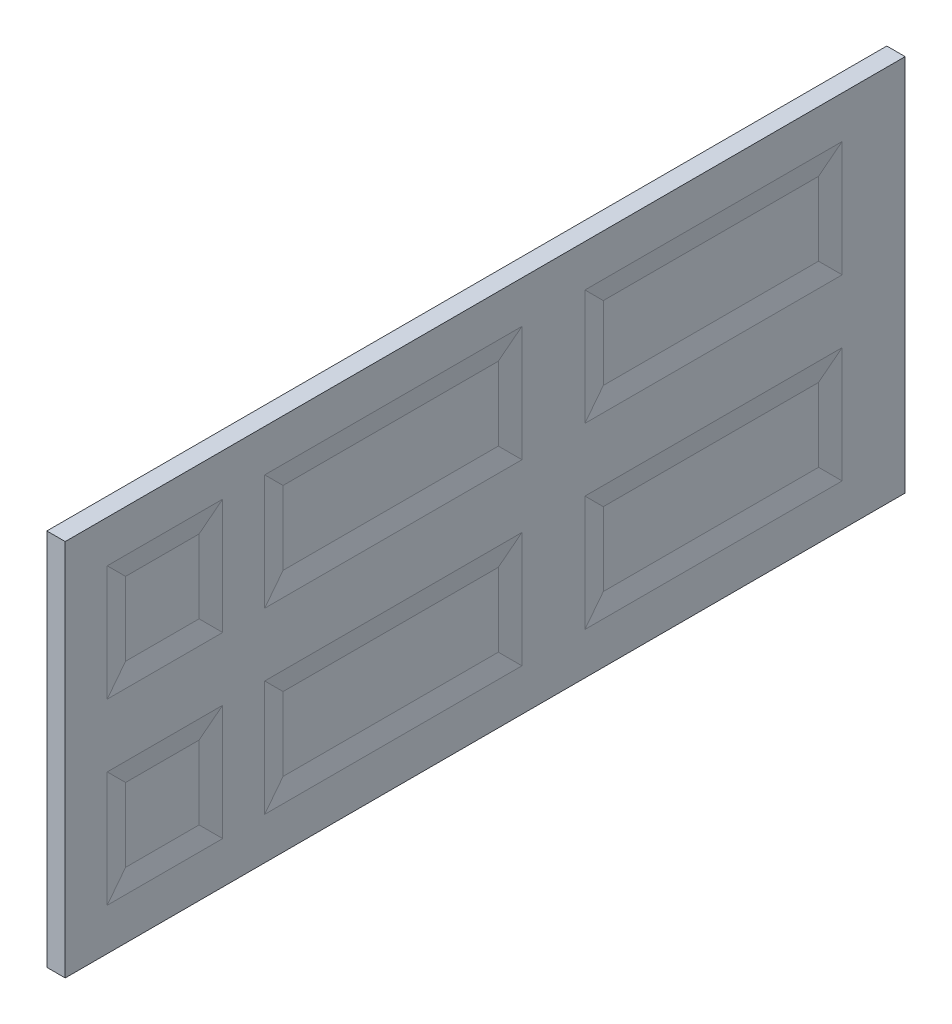
from build123d import *
from OCP.BRepFilletAPI import BRepFilletAPI_MakeChamfer

# Parameters (mm, degrees)
SKETCH1_W           = 914.4
SKETCH1_H           = 2032
BOSS_EXTRUDE1_DEPTH = 44.45
SKETCH2_W           = 177.8
SKETCH2_H           = 520.7
SKETCH2_H_2         = 177.8
CUT_EXTRUDE1_DEPTH  = 6.35
CHAMFER1_SIZE       = 50.8
CHAMFER1_SIZE_2     = 6.35
SKETCH3_W           = 168.710436435
SKETCH3_H           = 525.244781783
SKETCH3_H_2         = 168.710436435
SKETCH3_H_3         = 525.244781782
CUT_EXTRUDE2_DEPTH  = 6.35
CHAMFER2_SIZE       = 50.8
CHAMFER2_SIZE_2     = 6.35


with BuildPart() as part:
    # Sketch1 → Boss-Extrude1 (new body)
    with BuildSketch(Plane.YZ):
        Rectangle(SKETCH1_W, SKETCH1_H)
    extrude(amount=BOSS_EXTRUDE1_DEPTH)

    # Sketch2 → Cut-Extrude1 (cut)
    with BuildSketch(Plane.YZ.offset(44.45)):
        with Locations((-215.9, 222.25)):
            Rectangle(SKETCH2_W, SKETCH2_H)
        with Locations((-215.9, 774.7)):
            Rectangle(SKETCH2_W, SKETCH2_H_2)
        with Locations((-215.9, -552.45)):
            Rectangle(SKETCH2_W, SKETCH2_H)
        with Locations((215.9, -552.45)):
            Rectangle(SKETCH2_W, SKETCH2_H)
        with Locations((215.9, 222.25)):
            Rectangle(SKETCH2_W, SKETCH2_H)
        with Locations((215.9, 774.7)):
            Rectangle(SKETCH2_W, SKETCH2_H_2)
    extrude(amount=-CUT_EXTRUDE1_DEPTH, mode=Mode.SUBTRACT)

    # Chamfer1
    chamfer1_edges_1 = [part.edges().sort_by_distance(p)[0] for p in [
        (44.45, 215.9, -812.8),
    ]]
    chamfer1_side_1 = [part.faces().sort_by_distance(p)[0] for p in [
        (44.45, 215.9, -812.927),
    ]]
    chamfer1_edges_2 = [part.edges().sort_by_distance(p)[0] for p in [
        (44.45, 304.8, -552.45),
    ]]
    chamfer1_side_2 = [part.faces().sort_by_distance(p)[0] for p in [
        (44.45, 304.927, -552.45),
    ]]
    chamfer1_edges_3 = [part.edges().sort_by_distance(p)[0] for p in [
        (44.45, 215.9, -292.1),
    ]]
    chamfer1_side_3 = [part.faces().sort_by_distance(p)[0] for p in [
        (44.45, 215.9, -291.973),
    ]]
    chamfer1_edges_4 = [part.edges().sort_by_distance(p)[0] for p in [
        (44.45, 127, -552.45),
    ]]
    chamfer1_side_4 = [part.faces().sort_by_distance(p)[0] for p in [
        (44.45, 126.873, -552.45),
    ]]
    chamfer1_edges_5 = [part.edges().sort_by_distance(p)[0] for p in [
        (44.45, -127, -552.45),
    ]]
    chamfer1_side_5 = [part.faces().sort_by_distance(p)[0] for p in [
        (44.45, -126.873, -552.45),
    ]]
    chamfer1_edges_6 = [part.edges().sort_by_distance(p)[0] for p in [
        (44.45, -215.9, -812.8),
    ]]
    chamfer1_side_6 = [part.faces().sort_by_distance(p)[0] for p in [
        (44.45, -215.9, -812.927),
    ]]
    chamfer1_edges_7 = [part.edges().sort_by_distance(p)[0] for p in [
        (44.45, -215.9, -292.1),
    ]]
    chamfer1_side_7 = [part.faces().sort_by_distance(p)[0] for p in [
        (44.45, -215.9, -291.973),
    ]]
    chamfer1_edges_8 = [part.edges().sort_by_distance(p)[0] for p in [
        (44.45, -304.8, -552.45),
    ]]
    chamfer1_side_8 = [part.faces().sort_by_distance(p)[0] for p in [
        (44.45, -304.927, -552.45),
    ]]
    chamfer1_edges_9 = [part.edges().sort_by_distance(p)[0] for p in [
        (44.45, 215.9, -38.1),
    ]]
    chamfer1_side_9 = [part.faces().sort_by_distance(p)[0] for p in [
        (44.45, 215.9, -38.227),
    ]]
    chamfer1_edges_10 = [part.edges().sort_by_distance(p)[0] for p in [
        (44.45, 304.8, 222.25),
    ]]
    chamfer1_side_10 = [part.faces().sort_by_distance(p)[0] for p in [
        (44.45, 304.927, 222.25),
    ]]
    chamfer1_edges_11 = [part.edges().sort_by_distance(p)[0] for p in [
        (44.45, 215.9, 482.6),
    ]]
    chamfer1_side_11 = [part.faces().sort_by_distance(p)[0] for p in [
        (44.45, 215.9, 482.727),
    ]]
    chamfer1_edges_12 = [part.edges().sort_by_distance(p)[0] for p in [
        (44.45, 127, 222.25),
    ]]
    chamfer1_side_12 = [part.faces().sort_by_distance(p)[0] for p in [
        (44.45, 126.873, 222.25),
    ]]
    chamfer1_edges_13 = [part.edges().sort_by_distance(p)[0] for p in [
        (44.45, -215.9, -38.1),
    ]]
    chamfer1_side_13 = [part.faces().sort_by_distance(p)[0] for p in [
        (44.45, -215.9, -38.227),
    ]]
    chamfer1_edges_14 = [part.edges().sort_by_distance(p)[0] for p in [
        (44.45, -127, 222.25),
    ]]
    chamfer1_side_14 = [part.faces().sort_by_distance(p)[0] for p in [
        (44.45, -126.873, 222.25),
    ]]
    chamfer1_edges_15 = [part.edges().sort_by_distance(p)[0] for p in [
        (44.45, -304.8, 222.25),
    ]]
    chamfer1_side_15 = [part.faces().sort_by_distance(p)[0] for p in [
        (44.45, -304.927, 222.25),
    ]]
    chamfer1_edges_16 = [part.edges().sort_by_distance(p)[0] for p in [
        (44.45, -215.9, 482.6),
    ]]
    chamfer1_side_16 = [part.faces().sort_by_distance(p)[0] for p in [
        (44.45, -215.9, 482.727),
    ]]
    chamfer1_edges_17 = [part.edges().sort_by_distance(p)[0] for p in [
        (44.45, 304.8, 774.7),
    ]]
    chamfer1_side_17 = [part.faces().sort_by_distance(p)[0] for p in [
        (44.45, 304.927, 774.7),
    ]]
    chamfer1_edges_18 = [part.edges().sort_by_distance(p)[0] for p in [
        (44.45, 215.9, 685.8),
    ]]
    chamfer1_side_18 = [part.faces().sort_by_distance(p)[0] for p in [
        (44.45, 215.9, 685.673),
    ]]
    chamfer1_edges_19 = [part.edges().sort_by_distance(p)[0] for p in [
        (44.45, 215.9, 863.6),
    ]]
    chamfer1_side_19 = [part.faces().sort_by_distance(p)[0] for p in [
        (44.45, 215.9, 863.727),
    ]]
    chamfer1_edges_20 = [part.edges().sort_by_distance(p)[0] for p in [
        (44.45, 127, 774.7),
    ]]
    chamfer1_side_20 = [part.faces().sort_by_distance(p)[0] for p in [
        (44.45, 126.873, 774.7),
    ]]
    chamfer1_edges_21 = [part.edges().sort_by_distance(p)[0] for p in [
        (44.45, -127, 774.7),
    ]]
    chamfer1_side_21 = [part.faces().sort_by_distance(p)[0] for p in [
        (44.45, -126.873, 774.7),
    ]]
    chamfer1_edges_22 = [part.edges().sort_by_distance(p)[0] for p in [
        (44.45, -215.9, 685.8),
    ]]
    chamfer1_side_22 = [part.faces().sort_by_distance(p)[0] for p in [
        (44.45, -215.9, 685.673),
    ]]
    chamfer1_edges_23 = [part.edges().sort_by_distance(p)[0] for p in [
        (44.45, -304.8, 774.7),
    ]]
    chamfer1_side_23 = [part.faces().sort_by_distance(p)[0] for p in [
        (44.45, -304.927, 774.7),
    ]]
    chamfer1_edges_24 = [part.edges().sort_by_distance(p)[0] for p in [
        (44.45, -215.9, 863.6),
    ]]
    chamfer1_side_24 = [part.faces().sort_by_distance(p)[0] for p in [
        (44.45, -215.9, 863.727),
    ]]
    chamfer1 = BRepFilletAPI_MakeChamfer(part.part.solid().wrapped)
    for e in chamfer1_edges_1:
        chamfer1.Add(CHAMFER1_SIZE - 0.0001, CHAMFER1_SIZE_2 - 0.0001, e.wrapped, chamfer1_side_1[0].wrapped)
    for e in chamfer1_edges_2:
        chamfer1.Add(CHAMFER1_SIZE - 0.0001, CHAMFER1_SIZE_2 - 0.0001, e.wrapped, chamfer1_side_2[0].wrapped)
    for e in chamfer1_edges_3:
        chamfer1.Add(CHAMFER1_SIZE - 0.0001, CHAMFER1_SIZE_2 - 0.0001, e.wrapped, chamfer1_side_3[0].wrapped)
    for e in chamfer1_edges_4:
        chamfer1.Add(CHAMFER1_SIZE - 0.0001, CHAMFER1_SIZE_2 - 0.0001, e.wrapped, chamfer1_side_4[0].wrapped)
    for e in chamfer1_edges_5:
        chamfer1.Add(CHAMFER1_SIZE - 0.0001, CHAMFER1_SIZE_2 - 0.0001, e.wrapped, chamfer1_side_5[0].wrapped)
    for e in chamfer1_edges_6:
        chamfer1.Add(CHAMFER1_SIZE - 0.0001, CHAMFER1_SIZE_2 - 0.0001, e.wrapped, chamfer1_side_6[0].wrapped)
    for e in chamfer1_edges_7:
        chamfer1.Add(CHAMFER1_SIZE - 0.0001, CHAMFER1_SIZE_2 - 0.0001, e.wrapped, chamfer1_side_7[0].wrapped)
    for e in chamfer1_edges_8:
        chamfer1.Add(CHAMFER1_SIZE - 0.0001, CHAMFER1_SIZE_2 - 0.0001, e.wrapped, chamfer1_side_8[0].wrapped)
    for e in chamfer1_edges_9:
        chamfer1.Add(CHAMFER1_SIZE - 0.0001, CHAMFER1_SIZE_2 - 0.0001, e.wrapped, chamfer1_side_9[0].wrapped)
    for e in chamfer1_edges_10:
        chamfer1.Add(CHAMFER1_SIZE - 0.0001, CHAMFER1_SIZE_2 - 0.0001, e.wrapped, chamfer1_side_10[0].wrapped)
    for e in chamfer1_edges_11:
        chamfer1.Add(CHAMFER1_SIZE - 0.0001, CHAMFER1_SIZE_2 - 0.0001, e.wrapped, chamfer1_side_11[0].wrapped)
    for e in chamfer1_edges_12:
        chamfer1.Add(CHAMFER1_SIZE - 0.0001, CHAMFER1_SIZE_2 - 0.0001, e.wrapped, chamfer1_side_12[0].wrapped)
    for e in chamfer1_edges_13:
        chamfer1.Add(CHAMFER1_SIZE - 0.0001, CHAMFER1_SIZE_2 - 0.0001, e.wrapped, chamfer1_side_13[0].wrapped)
    for e in chamfer1_edges_14:
        chamfer1.Add(CHAMFER1_SIZE - 0.0001, CHAMFER1_SIZE_2 - 0.0001, e.wrapped, chamfer1_side_14[0].wrapped)
    for e in chamfer1_edges_15:
        chamfer1.Add(CHAMFER1_SIZE - 0.0001, CHAMFER1_SIZE_2 - 0.0001, e.wrapped, chamfer1_side_15[0].wrapped)
    for e in chamfer1_edges_16:
        chamfer1.Add(CHAMFER1_SIZE - 0.0001, CHAMFER1_SIZE_2 - 0.0001, e.wrapped, chamfer1_side_16[0].wrapped)
    for e in chamfer1_edges_17:
        chamfer1.Add(CHAMFER1_SIZE - 0.0001, CHAMFER1_SIZE_2 - 0.0001, e.wrapped, chamfer1_side_17[0].wrapped)
    for e in chamfer1_edges_18:
        chamfer1.Add(CHAMFER1_SIZE - 0.0001, CHAMFER1_SIZE_2 - 0.0001, e.wrapped, chamfer1_side_18[0].wrapped)
    for e in chamfer1_edges_19:
        chamfer1.Add(CHAMFER1_SIZE - 0.0001, CHAMFER1_SIZE_2 - 0.0001, e.wrapped, chamfer1_side_19[0].wrapped)
    for e in chamfer1_edges_20:
        chamfer1.Add(CHAMFER1_SIZE - 0.0001, CHAMFER1_SIZE_2 - 0.0001, e.wrapped, chamfer1_side_20[0].wrapped)
    for e in chamfer1_edges_21:
        chamfer1.Add(CHAMFER1_SIZE - 0.0001, CHAMFER1_SIZE_2 - 0.0001, e.wrapped, chamfer1_side_21[0].wrapped)
    for e in chamfer1_edges_22:
        chamfer1.Add(CHAMFER1_SIZE - 0.0001, CHAMFER1_SIZE_2 - 0.0001, e.wrapped, chamfer1_side_22[0].wrapped)
    for e in chamfer1_edges_23:
        chamfer1.Add(CHAMFER1_SIZE - 0.0001, CHAMFER1_SIZE_2 - 0.0001, e.wrapped, chamfer1_side_23[0].wrapped)
    for e in chamfer1_edges_24:
        chamfer1.Add(CHAMFER1_SIZE - 0.0001, CHAMFER1_SIZE_2 - 0.0001, e.wrapped, chamfer1_side_24[0].wrapped)
    add(Compound.cast(chamfer1.Shape()), mode=Mode.REPLACE)  # a hair under: the kernel refuses the full size

    # Sketch3 → Cut-Extrude2 (cut)
    with BuildSketch(Plane(origin=(0, 0, 0), x_dir=(0, -1, 0), z_dir=(-1, 0, 0))):
        with Locations((-220.444781783, 229.067172674)):
            Rectangle(SKETCH3_W, SKETCH3_H)
        with Locations((-220.444781783, 779.244781783)):
            Rectangle(SKETCH3_W, SKETCH3_H_2)
        with Locations((-220.444781783, -550.177609109)):
            Rectangle(SKETCH3_W, SKETCH3_H_3)
        with Locations((202.265654653, -550.177609109)):
            Rectangle(SKETCH3_W, SKETCH3_H_3)
        with Locations((202.265654653, 229.067172674)):
            Rectangle(SKETCH3_W, SKETCH3_H)
        with Locations((202.265654653, 779.244781783)):
            Rectangle(SKETCH3_W, SKETCH3_H_2)
    extrude(amount=-CUT_EXTRUDE2_DEPTH, mode=Mode.SUBTRACT)

    # Chamfer2
    chamfer2_edges_1 = [part.edges().sort_by_distance(p)[0] for p in [
        (0, -202.265654653, -812.8),
    ]]
    chamfer2_side_1 = [part.faces().sort_by_distance(p)[0] for p in [
        (0, -202.265654653, -812.927),
    ]]
    chamfer2_edges_2 = [part.edges().sort_by_distance(p)[0] for p in [
        (0, -286.62087287, -550.177609109),
    ]]
    chamfer2_side_2 = [part.faces().sort_by_distance(p)[0] for p in [
        (0, -286.74787287, -550.177609109),
    ]]
    chamfer2_edges_3 = [part.edges().sort_by_distance(p)[0] for p in [
        (0, -202.265654653, -287.555218218),
    ]]
    chamfer2_side_3 = [part.faces().sort_by_distance(p)[0] for p in [
        (0, -202.265654653, -287.428218218),
    ]]
    chamfer2_edges_4 = [part.edges().sort_by_distance(p)[0] for p in [
        (0, -117.910436435, -550.177609109),
    ]]
    chamfer2_side_4 = [part.faces().sort_by_distance(p)[0] for p in [
        (0, -117.783436435, -550.177609109),
    ]]
    chamfer2_edges_5 = [part.edges().sort_by_distance(p)[0] for p in [
        (0, 136.089563565, -550.177609109),
    ]]
    chamfer2_side_5 = [part.faces().sort_by_distance(p)[0] for p in [
        (0, 135.962563565, -550.177609109),
    ]]
    chamfer2_edges_6 = [part.edges().sort_by_distance(p)[0] for p in [
        (0, 220.444781782, -812.8),
    ]]
    chamfer2_side_6 = [part.faces().sort_by_distance(p)[0] for p in [
        (0, 220.444781782, -812.927),
    ]]
    chamfer2_edges_7 = [part.edges().sort_by_distance(p)[0] for p in [
        (0, 304.8, -550.177609109),
    ]]
    chamfer2_side_7 = [part.faces().sort_by_distance(p)[0] for p in [
        (0, 304.927, -550.177609109),
    ]]
    chamfer2_edges_8 = [part.edges().sort_by_distance(p)[0] for p in [
        (0, 220.444781782, -287.555218218),
    ]]
    chamfer2_side_8 = [part.faces().sort_by_distance(p)[0] for p in [
        (0, 220.444781782, -287.428218218),
    ]]
    chamfer2_edges_9 = [part.edges().sort_by_distance(p)[0] for p in [
        (0, -202.265654653, -33.555218218),
    ]]
    chamfer2_side_9 = [part.faces().sort_by_distance(p)[0] for p in [
        (0, -202.265654653, -33.682218218),
    ]]
    chamfer2_edges_10 = [part.edges().sort_by_distance(p)[0] for p in [
        (0, -286.62087287, 229.067172674),
    ]]
    chamfer2_side_10 = [part.faces().sort_by_distance(p)[0] for p in [
        (0, -286.74787287, 229.067172674),
    ]]
    chamfer2_edges_11 = [part.edges().sort_by_distance(p)[0] for p in [
        (0, -202.265654653, 491.689563565),
    ]]
    chamfer2_side_11 = [part.faces().sort_by_distance(p)[0] for p in [
        (0, -202.265654653, 491.816563565),
    ]]
    chamfer2_edges_12 = [part.edges().sort_by_distance(p)[0] for p in [
        (0, -117.910436435, 229.067172674),
    ]]
    chamfer2_side_12 = [part.faces().sort_by_distance(p)[0] for p in [
        (0, -117.783436435, 229.067172674),
    ]]
    chamfer2_edges_13 = [part.edges().sort_by_distance(p)[0] for p in [
        (0, 136.089563565, 229.067172674),
    ]]
    chamfer2_side_13 = [part.faces().sort_by_distance(p)[0] for p in [
        (0, 135.962563565, 229.067172674),
    ]]
    chamfer2_edges_14 = [part.edges().sort_by_distance(p)[0] for p in [
        (0, 220.444781782, -33.555218218),
    ]]
    chamfer2_side_14 = [part.faces().sort_by_distance(p)[0] for p in [
        (0, 220.444781782, -33.682218218),
    ]]
    chamfer2_edges_15 = [part.edges().sort_by_distance(p)[0] for p in [
        (0, 304.8, 229.067172674),
    ]]
    chamfer2_side_15 = [part.faces().sort_by_distance(p)[0] for p in [
        (0, 304.927, 229.067172674),
    ]]
    chamfer2_edges_16 = [part.edges().sort_by_distance(p)[0] for p in [
        (0, 220.444781782, 491.689563565),
    ]]
    chamfer2_side_16 = [part.faces().sort_by_distance(p)[0] for p in [
        (0, 220.444781782, 491.816563565),
    ]]
    chamfer2_edges_17 = [part.edges().sort_by_distance(p)[0] for p in [
        (0, -202.265654653, 694.889563565),
    ]]
    chamfer2_side_17 = [part.faces().sort_by_distance(p)[0] for p in [
        (0, -202.265654653, 694.762563565),
    ]]
    chamfer2_edges_18 = [part.edges().sort_by_distance(p)[0] for p in [
        (0, -286.62087287, 779.244781782),
    ]]
    chamfer2_side_18 = [part.faces().sort_by_distance(p)[0] for p in [
        (0, -286.74787287, 779.244781782),
    ]]
    chamfer2_edges_19 = [part.edges().sort_by_distance(p)[0] for p in [
        (0, -202.265654653, 863.6),
    ]]
    chamfer2_side_19 = [part.faces().sort_by_distance(p)[0] for p in [
        (0, -202.265654653, 863.727),
    ]]
    chamfer2_edges_20 = [part.edges().sort_by_distance(p)[0] for p in [
        (0, -117.910436435, 779.244781782),
    ]]
    chamfer2_side_20 = [part.faces().sort_by_distance(p)[0] for p in [
        (0, -117.783436435, 779.244781782),
    ]]
    chamfer2_edges_21 = [part.edges().sort_by_distance(p)[0] for p in [
        (0, 220.444781782, 694.889563565),
    ]]
    chamfer2_side_21 = [part.faces().sort_by_distance(p)[0] for p in [
        (0, 220.444781782, 694.762563565),
    ]]
    chamfer2_edges_22 = [part.edges().sort_by_distance(p)[0] for p in [
        (0, 136.089563565, 779.244781782),
    ]]
    chamfer2_side_22 = [part.faces().sort_by_distance(p)[0] for p in [
        (0, 135.962563565, 779.244781782),
    ]]
    chamfer2_edges_23 = [part.edges().sort_by_distance(p)[0] for p in [
        (0, 220.444781782, 863.6),
    ]]
    chamfer2_side_23 = [part.faces().sort_by_distance(p)[0] for p in [
        (0, 220.444781782, 863.727),
    ]]
    chamfer2_edges_24 = [part.edges().sort_by_distance(p)[0] for p in [
        (0, 304.8, 779.244781782),
    ]]
    chamfer2_side_24 = [part.faces().sort_by_distance(p)[0] for p in [
        (0, 304.927, 779.244781782),
    ]]
    chamfer2 = BRepFilletAPI_MakeChamfer(part.part.solid().wrapped)
    for e in chamfer2_edges_1:
        chamfer2.Add(CHAMFER2_SIZE - 0.0001, CHAMFER2_SIZE_2 - 0.0001, e.wrapped, chamfer2_side_1[0].wrapped)
    for e in chamfer2_edges_2:
        chamfer2.Add(CHAMFER2_SIZE - 0.0001, CHAMFER2_SIZE_2 - 0.0001, e.wrapped, chamfer2_side_2[0].wrapped)
    for e in chamfer2_edges_3:
        chamfer2.Add(CHAMFER2_SIZE - 0.0001, CHAMFER2_SIZE_2 - 0.0001, e.wrapped, chamfer2_side_3[0].wrapped)
    for e in chamfer2_edges_4:
        chamfer2.Add(CHAMFER2_SIZE - 0.0001, CHAMFER2_SIZE_2 - 0.0001, e.wrapped, chamfer2_side_4[0].wrapped)
    for e in chamfer2_edges_5:
        chamfer2.Add(CHAMFER2_SIZE - 0.0001, CHAMFER2_SIZE_2 - 0.0001, e.wrapped, chamfer2_side_5[0].wrapped)
    for e in chamfer2_edges_6:
        chamfer2.Add(CHAMFER2_SIZE - 0.0001, CHAMFER2_SIZE_2 - 0.0001, e.wrapped, chamfer2_side_6[0].wrapped)
    for e in chamfer2_edges_7:
        chamfer2.Add(CHAMFER2_SIZE - 0.0001, CHAMFER2_SIZE_2 - 0.0001, e.wrapped, chamfer2_side_7[0].wrapped)
    for e in chamfer2_edges_8:
        chamfer2.Add(CHAMFER2_SIZE - 0.0001, CHAMFER2_SIZE_2 - 0.0001, e.wrapped, chamfer2_side_8[0].wrapped)
    for e in chamfer2_edges_9:
        chamfer2.Add(CHAMFER2_SIZE - 0.0001, CHAMFER2_SIZE_2 - 0.0001, e.wrapped, chamfer2_side_9[0].wrapped)
    for e in chamfer2_edges_10:
        chamfer2.Add(CHAMFER2_SIZE - 0.0001, CHAMFER2_SIZE_2 - 0.0001, e.wrapped, chamfer2_side_10[0].wrapped)
    for e in chamfer2_edges_11:
        chamfer2.Add(CHAMFER2_SIZE - 0.0001, CHAMFER2_SIZE_2 - 0.0001, e.wrapped, chamfer2_side_11[0].wrapped)
    for e in chamfer2_edges_12:
        chamfer2.Add(CHAMFER2_SIZE - 0.0001, CHAMFER2_SIZE_2 - 0.0001, e.wrapped, chamfer2_side_12[0].wrapped)
    for e in chamfer2_edges_13:
        chamfer2.Add(CHAMFER2_SIZE - 0.0001, CHAMFER2_SIZE_2 - 0.0001, e.wrapped, chamfer2_side_13[0].wrapped)
    for e in chamfer2_edges_14:
        chamfer2.Add(CHAMFER2_SIZE - 0.0001, CHAMFER2_SIZE_2 - 0.0001, e.wrapped, chamfer2_side_14[0].wrapped)
    for e in chamfer2_edges_15:
        chamfer2.Add(CHAMFER2_SIZE - 0.0001, CHAMFER2_SIZE_2 - 0.0001, e.wrapped, chamfer2_side_15[0].wrapped)
    for e in chamfer2_edges_16:
        chamfer2.Add(CHAMFER2_SIZE - 0.0001, CHAMFER2_SIZE_2 - 0.0001, e.wrapped, chamfer2_side_16[0].wrapped)
    for e in chamfer2_edges_17:
        chamfer2.Add(CHAMFER2_SIZE - 0.0001, CHAMFER2_SIZE_2 - 0.0001, e.wrapped, chamfer2_side_17[0].wrapped)
    for e in chamfer2_edges_18:
        chamfer2.Add(CHAMFER2_SIZE - 0.0001, CHAMFER2_SIZE_2 - 0.0001, e.wrapped, chamfer2_side_18[0].wrapped)
    for e in chamfer2_edges_19:
        chamfer2.Add(CHAMFER2_SIZE - 0.0001, CHAMFER2_SIZE_2 - 0.0001, e.wrapped, chamfer2_side_19[0].wrapped)
    for e in chamfer2_edges_20:
        chamfer2.Add(CHAMFER2_SIZE - 0.0001, CHAMFER2_SIZE_2 - 0.0001, e.wrapped, chamfer2_side_20[0].wrapped)
    for e in chamfer2_edges_21:
        chamfer2.Add(CHAMFER2_SIZE - 0.0001, CHAMFER2_SIZE_2 - 0.0001, e.wrapped, chamfer2_side_21[0].wrapped)
    for e in chamfer2_edges_22:
        chamfer2.Add(CHAMFER2_SIZE - 0.0001, CHAMFER2_SIZE_2 - 0.0001, e.wrapped, chamfer2_side_22[0].wrapped)
    for e in chamfer2_edges_23:
        chamfer2.Add(CHAMFER2_SIZE - 0.0001, CHAMFER2_SIZE_2 - 0.0001, e.wrapped, chamfer2_side_23[0].wrapped)
    for e in chamfer2_edges_24:
        chamfer2.Add(CHAMFER2_SIZE - 0.0001, CHAMFER2_SIZE_2 - 0.0001, e.wrapped, chamfer2_side_24[0].wrapped)
    add(Compound.cast(chamfer2.Shape()), mode=Mode.REPLACE)  # a hair under: the kernel refuses the full size


solid = part.part
